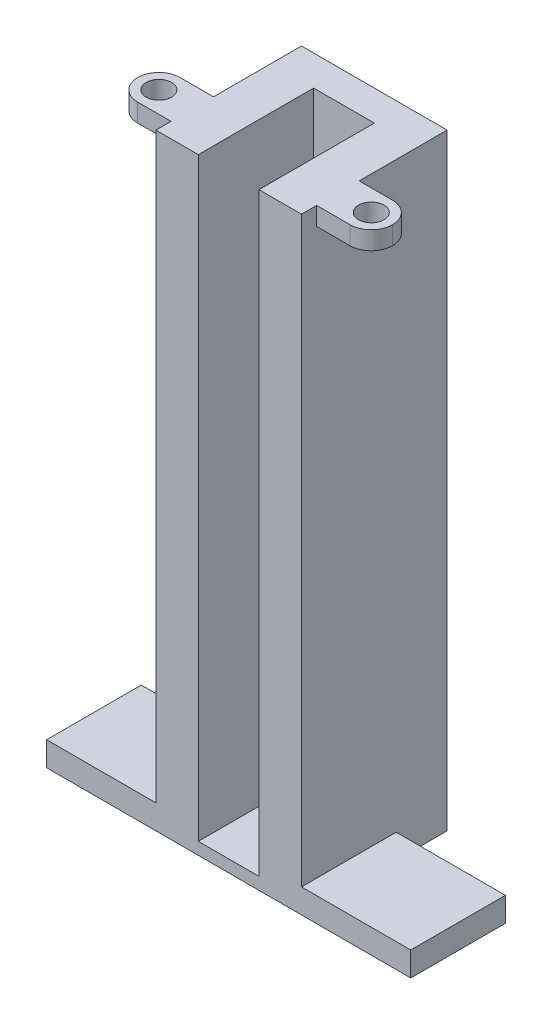
from build123d import *

# Parameters (mm, degrees)
SKETCH1_W            = 24
SKETCH1_H            = 24
BOSS_EXTRUDE1_DEPTH  = 100
SKETCH3_W            = 10
SKETCH3_H            = 19
CUT_EXTRUDE1_DEPTH   = 98
SKETCH6_W            = 24
SKETCH6_H            = 4
BOSS_EXTRUDE3_DEPTH  = 18
SKETCH7_W            = 18
SKETCH7_H            = 8.4
CUT_EXTRUDE3_DEPTH   = 4
SKETCH8_R            = 4
CUT_EXTRUDE4_DEPTH   = 1
SKETCH9_W            = 9
SKETCH9_H            = 7
BOSS_EXTRUDE4_DEPTH  = 3
FILLET1_R            = 3.5
SKETCH10_R           = 2.1
CUT_EXTRUDE5_DEPTH   = 3
FILLET1_OF_MIRROR3_R = 3.5


with BuildPart() as part:
    # Sketch1 → Boss-Extrude1 (new body)
    with BuildSketch(Plane(origin=(0, 0, 0), x_dir=(1, 0, 0), z_dir=(0, 1, 0))):
        Rectangle(SKETCH1_W, SKETCH1_H)
    extrude(amount=BOSS_EXTRUDE1_DEPTH)

    # Sketch3 → Cut-Extrude1 (cut)
    with BuildSketch(Plane(origin=(0, 100, 0), x_dir=(1, 0, 0), z_dir=(0, 1, 0))):
        with Locations((0, -2.5)):
            Rectangle(SKETCH3_W, SKETCH3_H)
    extrude(amount=-CUT_EXTRUDE1_DEPTH, mode=Mode.SUBTRACT)

    # Sketch6 → Boss-Extrude3 (add)
    with BuildSketch(Plane.ZY.offset(12)):
        with Locations((0, 2)):
            Rectangle(SKETCH6_W, SKETCH6_H)
    boss_extrude3 = extrude(amount=BOSS_EXTRUDE3_DEPTH)

    # Sketch7 → Cut-Extrude3 (cut)
    with BuildSketch(Plane(origin=(0, 4, 0), x_dir=(1, 0, 0), z_dir=(0, 1, 0))):
        with Locations((-21, 7.8)):
            Rectangle(SKETCH7_W, SKETCH7_H)
    cut_extrude3 = extrude(amount=-CUT_EXTRUDE3_DEPTH, mode=Mode.SUBTRACT)

    # Mirror2: Boss-Extrude3, Cut-Extrude3 across plane
    add(boss_extrude3.mirror(Plane(origin=(0, 0, 0), x_dir=(0, 0, 1), z_dir=(1, 0, 0))))
    add(cut_extrude3.mirror(Plane(origin=(0, 0, 0), x_dir=(0, 0, 1), z_dir=(1, 0, 0))), mode=Mode.SUBTRACT)

    # Sketch8 → Cut-Extrude4 (cut)
    with BuildSketch(Plane(origin=(0, 2, 0), x_dir=(1, 0, 0), z_dir=(0, 1, 0))):
        with Locations(Location((0, 2, 0), (0, 0, 270))):
            Circle(SKETCH8_R)
    extrude(amount=-CUT_EXTRUDE4_DEPTH, mode=Mode.SUBTRACT)

    # Sketch9 → Boss-Extrude4 (add)
    with BuildSketch(Plane(origin=(0, 100, 0), x_dir=(1, 0, 0), z_dir=(0, 1, 0))):
        with Locations((-16.5, -6)):
            Rectangle(SKETCH9_W, SKETCH9_H)
    boss_extrude4 = extrude(amount=-BOSS_EXTRUDE4_DEPTH)

    # Fillet1
    fillet1_edges = [part.edges().sort_by_distance(p)[0] for p in [
        (-21, 98.5, 2.5),
        (-21, 98.5, 9.5),
    ]]
    fillet(fillet1_edges, radius=FILLET1_R - 0.0001)  # a hair under: the kernel refuses the full size

    # Sketch10 → Cut-Extrude5 (cut)
    with BuildSketch(Plane(origin=(0, 100, 0), x_dir=(1, 0, 0), z_dir=(0, 1, 0))):
        with Locations(Location((-17.5, -6, 0), (0, 0, 270))):
            Circle(SKETCH10_R)
    cut_extrude5 = extrude(amount=-CUT_EXTRUDE5_DEPTH, mode=Mode.SUBTRACT)

    # Mirror3: Boss-Extrude4, Cut-Extrude5 across plane
    add(boss_extrude4.mirror(Plane(origin=(0, 0, 0), x_dir=(0, 0, 1), z_dir=(1, 0, 0))))
    add(cut_extrude5.mirror(Plane(origin=(0, 0, 0), x_dir=(0, 0, 1), z_dir=(1, 0, 0))), mode=Mode.SUBTRACT)

    # Fillet1 of Mirror3
    fillet1_of_mirror3_edges = [part.edges().sort_by_distance(p)[0] for p in [
        (21, 98.5, 2.5),
        (21, 98.5, 9.5),
    ]]
    fillet(fillet1_of_mirror3_edges, radius=FILLET1_OF_MIRROR3_R - 0.0001)  # a hair under: the kernel refuses the full size


solid = part.part
